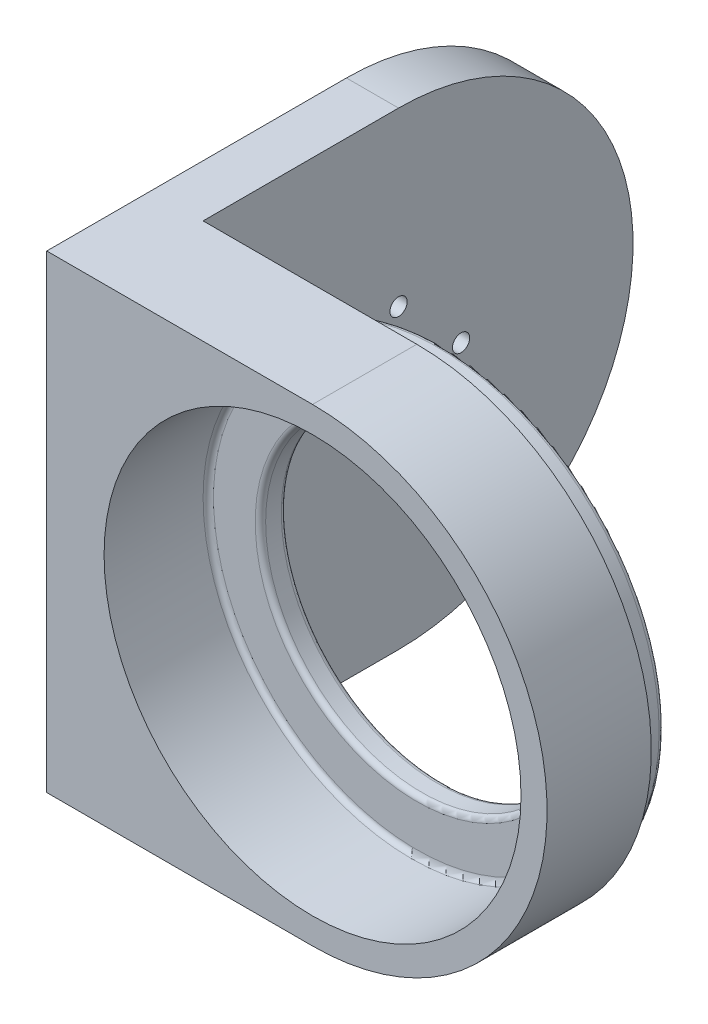
from build123d import *

# Parameters (mm, degrees)
SKETCH1_R           = 40
BOSS_EXTRUDE1_DEPTH = 40
SKETCH6_R           = 99.675751491
CUT_EXTRUDE3_DEPTH  = 20
SKETCH7_R           = 42.5
SKETCH7_R_2         = 30
BOSS_EXTRUDE4_DEPTH = 5
FILLET1_R           = 1
SKETCH8_R           = 1.65
SKETCH8_R_2         = 5
BOSS_EXTRUDE5_DEPTH = 10


with BuildPart() as part:
    # Sketch1 → Boss-Extrude1 (new body)
    with BuildSketch(Plane.XY):
        with BuildLine():
            Line((0, 45), (-41, 45))
            Line((-41, 45), (-41, -45))
            Line((-41, -45), (0, -45))
            ThreePointArc((0, -45), (45, 0), (0, 45))
        make_face()
        Circle(SKETCH1_R, mode=Mode.SUBTRACT)
    extrude(amount=BOSS_EXTRUDE1_DEPTH)

    # Sketch6 → Cut-Extrude3 (cut, symmetric)
    with BuildSketch(Plane(origin=(0, 0, 0), x_dir=(-1, 0, 0), z_dir=(0, 0, -1))):
        Circle(SKETCH6_R)
    extrude(amount=CUT_EXTRUDE3_DEPTH, both=True, mode=Mode.SUBTRACT)

    # Sketch7 → Boss-Extrude4 (add)
    with BuildSketch(Plane.XY.offset(20)):
        Circle(SKETCH7_R)
        Circle(SKETCH7_R_2, mode=Mode.SUBTRACT)
    extrude(amount=-BOSS_EXTRUDE4_DEPTH)

    # Fillet1
    # the kernel refuses this fillet: 1 mm, written as the material it adds along each edge
    with BuildSketch(Plane(origin=(0, 0, 20), x_dir=(1, 0, 0), z_dir=(0, -1, 0))) as fillet1_piece_1_section:
        with BuildLine():
            CenterArc((42.5 + FILLET1_R, -FILLET1_R), FILLET1_R, 90, 90)
            Line((42.5, -FILLET1_R), (42.5, 0))
            Line((42.5, 0), (42.5 + FILLET1_R, 0))
        make_face()
    fillet1_piece_1 = revolve(axis=Axis((0, 0, 20), (0, 0, 1)), revolution_arc=168.107148561, mode=Mode.PRIVATE)
    fillet1_piece_1 = split(fillet1_piece_1, bisect_by=Plane(origin=(-41, 42.392814896, 19.72810619), z_dir=(1, 0, 0)), keep=Keep.TOP, mode=Mode.PRIVATE)
    add(fillet1_piece_1)
    with BuildSketch(Plane(origin=(0, 0, 20), x_dir=(1, 0, 0), z_dir=(0, 1, 0))) as fillet1_piece_2:
        with BuildLine():
            CenterArc((40 - FILLET1_R, -FILLET1_R), FILLET1_R, 0, 90)
            Line((40 - FILLET1_R, 0), (40, 0))
            Line((40, 0), (40, -FILLET1_R))
        make_face()
    revolve(axis=Axis((0, 0, 20), (0, 0, -1)))
    with BuildSketch(Plane(origin=(0, 0, 20), x_dir=(-0.9785347047429207, -0.20608209920729434, 0), z_dir=(-0.20608209920729434, 0.9785347047429207, 0))) as fillet1_piece_3_section:
        with BuildLine():
            CenterArc((42.5 + FILLET1_R, -FILLET1_R), FILLET1_R, 90, 90)
            Line((42.5, -FILLET1_R), (42.5, 0))
            Line((42.5, 0), (42.5 + FILLET1_R, 0))
        make_face()
    fillet1_piece_3 = revolve(axis=Axis((0, 0, 20), (0, 0, 1)), revolution_arc=168.107148561, mode=Mode.PRIVATE)
    fillet1_piece_3 = split(fillet1_piece_3, bisect_by=Plane(origin=(-41, -42.392814308, 19.728106783), z_dir=(1, 0, 0)), keep=Keep.TOP, mode=Mode.PRIVATE)
    add(fillet1_piece_3)
    # the kernel refuses this fillet: 1 mm, written as the material it takes off along each edge
    with BuildSketch(Plane(origin=(0, 0, 15), x_dir=(1, 0, 0), z_dir=(0, -1, 0))) as fillet1_2_piece_1:
        with BuildLine():
            CenterArc((42.5 - FILLET1_R, FILLET1_R), FILLET1_R, 270, 90)
            Line((42.5, FILLET1_R), (42.5, 0))
            Line((42.5, 0), (42.5 - FILLET1_R, 0))
        make_face()
    revolve(axis=Axis((0, 0, 15), (0, 0, 1)), mode=Mode.SUBTRACT)
    with BuildSketch(Plane(origin=(0, 0, 15), x_dir=(1, 0, 0), z_dir=(0, -1, 0))) as fillet1_2_piece_2:
        with BuildLine():
            CenterArc((30 + FILLET1_R, FILLET1_R), FILLET1_R, 180, 90)
            Line((30 + FILLET1_R, 0), (30, 0))
            Line((30, 0), (30, FILLET1_R))
        make_face()
    revolve(axis=Axis((0, 0, 15), (0, 0, 1)), mode=Mode.SUBTRACT)
    with BuildSketch(Plane(origin=(0, 0, 20), x_dir=(1, 0, 0), z_dir=(0, -1, 0))) as fillet1_2_piece_3:
        with BuildLine():
            CenterArc((30 + FILLET1_R, -FILLET1_R), FILLET1_R, 90, 90)
            Line((30, -FILLET1_R), (30, 0))
            Line((30, 0), (30 + FILLET1_R, 0))
        make_face()
    revolve(axis=Axis((0, 0, 20), (0, 0, 1)), mode=Mode.SUBTRACT)

    # Sketch8 → Boss-Extrude5 (add)
    with BuildSketch(Plane.ZY.offset(41)):
        with BuildLine():
            Line((40, 45), (40, -45))
            Line((40, -45), (-17.5, -45))
            ThreePointArc((-17.5, -45), (-62.5, 0), (-17.5, 45))
            Line((-17.5, 45), (40, 45))
        make_face()
        with Locations(Location((-17.5, 12, 0), (0, 0, 270))):
            Circle(SKETCH8_R, mode=Mode.SUBTRACT)
        with Locations(Location((-17.5, 0, 0), (0, 0, 270))):
            Circle(SKETCH8_R_2, mode=Mode.SUBTRACT)
        with Locations(Location((-5.5, 0, 0), (0, 0, 270))):
            Circle(SKETCH8_R, mode=Mode.SUBTRACT)
        with Locations(Location((-17.5, -12, 0), (0, 0, 270))):
            Circle(SKETCH8_R, mode=Mode.SUBTRACT)
        with Locations(Location((-29.5, 0, 0), (0, 0, 270))):
            Circle(SKETCH8_R, mode=Mode.SUBTRACT)
    extrude(amount=BOSS_EXTRUDE5_DEPTH)


solid = part.part
